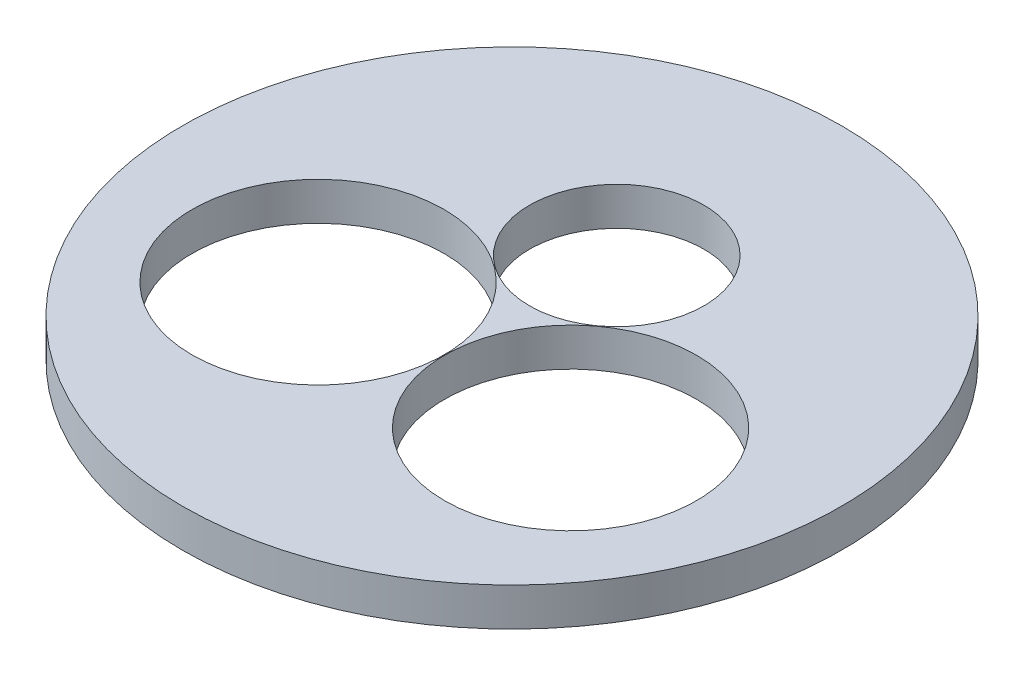
from build123d import *

# Parameters (mm, degrees)
SKETCH1_R           = 863.6
SKETCH1_R_2         = 330.2
SKETCH1_R_3         = 228.6
BOSS_EXTRUDE1_DEPTH = 100


with BuildPart() as part:
    # Sketch1 → Boss-Extrude1 (new body)
    with BuildSketch(Plane(origin=(0, 0, 0), x_dir=(1, 0, 0), z_dir=(0, 1, 0))):
        Circle(SKETCH1_R)
        with Locations((330.835, -177.391142404)):
            Circle(SKETCH1_R_2, mode=Mode.SUBTRACT)
        with Locations((0, 274.523238508)):
            Circle(SKETCH1_R_3, mode=Mode.SUBTRACT)
        with Locations((-330.835, -177.391142404)):
            Circle(SKETCH1_R_2, mode=Mode.SUBTRACT)
    extrude(amount=BOSS_EXTRUDE1_DEPTH)


solid = part.part
